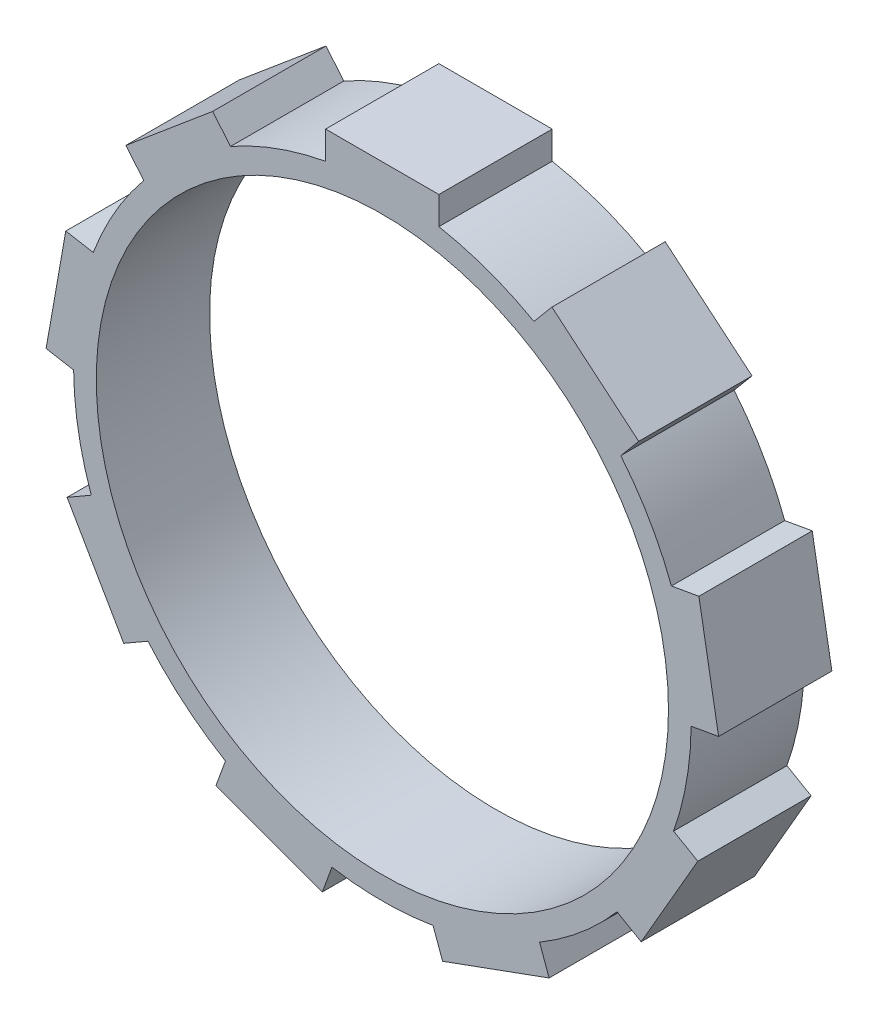
from build123d import *

# Parameters (mm, degrees)
CROQUIS1_R              = 25.25
SALIENTE_EXTRUIR1_DEPTH = 10


with BuildPart() as part:
    # Croquis1 → Saliente-Extruir1 (new body)
    with BuildSketch(Plane.XY):
        with BuildLine():
            Line((13.377784445, 23.740206051), (14.962174263, 25.628408308))
            Line((14.962174263, 25.628408308), (22.622618694, 19.200532211))
            Line((22.622618694, 19.200532211), (21.041092279, 17.315742424))
            ThreePointArc((21.041092279, 17.315742424), (23.593120433, 13.635511293), (25.507887736, 9.586978837))
            Line((25.507887736, 9.586978837), (27.935313767, 10.01499954))
            Line((27.935313767, 10.01499954), (29.671795544, 0.16692201))
            Line((29.671795544, 0.16692201), (27.2487565, -0.260325149))
            ThreePointArc((27.2487565, -0.260325149), (26.838116515, -4.719957833), (25.702566867, -9.052102322))
            Line((25.702566867, -9.052102322), (27.837209493, -10.284538817))
            Line((27.837209493, -10.284538817), (22.837209493, -18.944792854))
            Line((22.837209493, -18.944792854), (20.706424719, -17.714583691))
            ThreePointArc((20.706424719, -17.714583691), (17.525259607, -20.866906232), (13.870729308, -23.455604201))
            Line((13.870729308, -23.455604201), (14.713765522, -25.771827161))
            Line((14.713765522, -25.771827161), (5.316839314, -29.192028594))
            Line((5.316839314, -29.192028594), (4.475326685, -26.879991649))
            ThreePointArc((4.475326685, -26.879991649), (0.012138957, -27.249997296), (-4.45137665, -26.883968195))
            Line((-4.45137665, -26.883968195), (-5.294412863, -29.200191155))
            Line((-5.294412863, -29.200191155), (-14.691339071, -25.779989722))
            Line((-14.691339071, -25.779989722), (-13.849826442, -23.467952777))
            ThreePointArc((-13.849826442, -23.467952777), (-17.506661645, -20.882511775), (-20.690634002, -17.733024689))
            Line((-20.690634002, -17.733024689), (-22.825276628, -18.965461183))
            Line((-22.825276628, -18.965461183), (-27.825276628, -10.305207146))
            Line((-27.825276628, -10.305207146), (-25.694491854, -9.074997983))
            ThreePointArc((-25.694491854, -9.074997983), (-26.833900699, -4.743866911), (-27.248513754, -0.284601849))
            Line((-27.248513754, -0.284601849), (-29.675939784, 0.143418853))
            Line((-29.675939784, 0.143418853), (-27.939458008, 9.991496383))
            Line((-27.939458008, 9.991496383), (-25.516418964, 9.564249225))
            ThreePointArc((-25.516418964, 9.564249225), (-23.60525939, 13.614486003), (-21.056511087, 17.296989358))
            Line((-21.056511087, 17.296989358), (-22.640900904, 19.185191615))
            Line((-22.640900904, 19.185191615), (-14.980456473, 25.613067712))
            Line((-14.980456473, 25.613067712), (-13.398930058, 23.728277925))
            ThreePointArc((-13.398930058, 23.728277925), (-9.331454869, 25.602469608), (-5.011932865, 26.78512701))
            Line((-5.011932865, 26.78512701), (-5.011932865, 29.25))
            Line((-5.011932865, 29.25), (4.988067135, 29.25))
            Line((4.988067135, 29.25), (4.988067135, 26.789581674))
            ThreePointArc((4.988067135, 26.789581674), (9.308641092, 25.610773144), (13.377784445, 23.740206051))
        make_face()
        Circle(CROQUIS1_R, mode=Mode.SUBTRACT)
    extrude(amount=SALIENTE_EXTRUIR1_DEPTH)


solid = part.part
